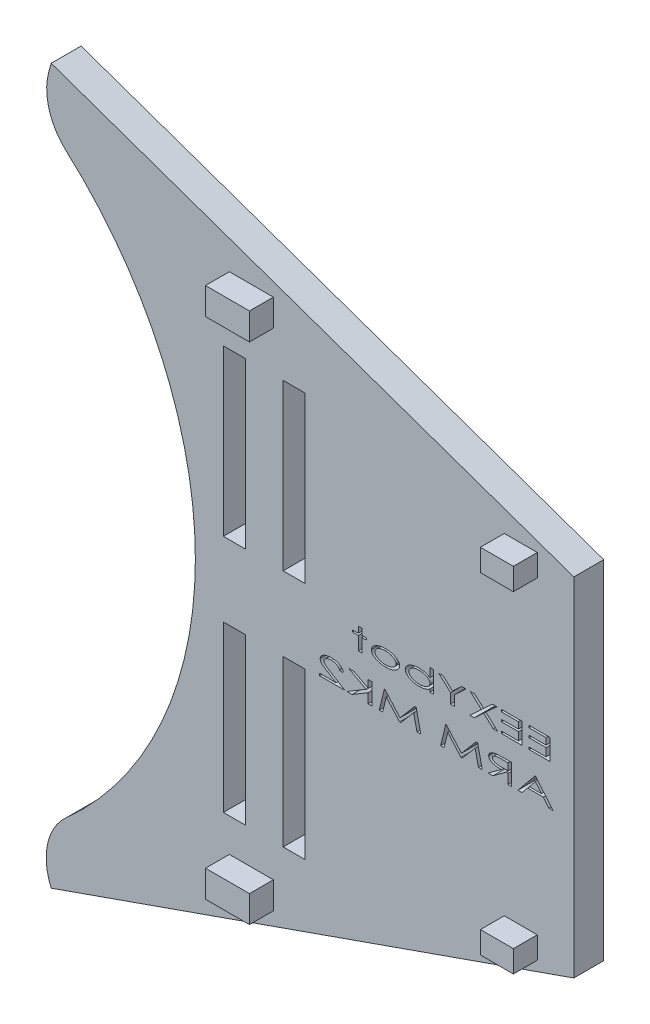
from build123d import *

# Parameters (mm, degrees)
EXTRUDE_1_DEPTH     = 5
FILLET_1_R          = 10
CUT_EXTRUDE_1_DEPTH = 107.69971335
SKETCH_3_W          = 3.678845839
SKETCH_3_H          = 27.591343796
CUT_EXTRUDE_2_DEPTH = 107.699713493
SKETCH_5_W          = 5.518268759
SKETCH_5_H          = 3.67884584
SKETCH_5_W_2        = 7.357691678
SKETCH_5_H_2        = 4.496367137
EXTRUDE_2_DEPTH     = 4


with BuildPart() as part:
    # 草图1 → 凸台-拉伸1 (new body)
    with BuildSketch(Plane.XY):
        with BuildLine():
            Line((0, 29.052064759), (0, -29.052064759))
            Line((0, -29.052064759), (-87.42568435, -59.751160027))
            Line((-87.42568435, -59.751160027), (-91.643949464, -53.551128693))
            ThreePointArc((-91.643949464, -53.551128693), (-63.451535914, -4.310229449), (-84.85515522, 48.23844723))
            ThreePointArc((-84.85515522, 48.23844723), (-87.784902179, 52.896492408), (-87.806774762, 58.399248419))
            Line((-87.806774762, 58.399248419), (-87.42568435, 59.751160027))
            Line((-87.42568435, 59.751160027), (0, 29.052064759))
        make_face()
    extrude(amount=EXTRUDE_1_DEPTH)

    # 圆角1
    # the kernel refuses this fillet: 10 mm, written as the material it takes off along each edge
    with BuildSketch(Plane(origin=(-91.643949464, -53.551128693, -21.327888809), x_dir=(0.5625146106856179, -0.8267873443426718, 0), z_dir=(0, 0, 1))) as fillet_1_piece_1:
        with BuildLine():
            CenterArc((9.351418919, 9.826918831), FILLET_1_R, 187.552141493, 71.772291788)
            Line((-0.561837747, 8.512634898), (-0.760102881, 8.48634922))
            ThreePointArc((-0.760102881, 8.48634922), (-0.340177879, 4.252406328), (-0.2, 0))
            Line((-0.2, 0), (0, -0.2))
            ThreePointArc((0, -0.2), (3.7494716, -0.2), (7.461893686, -0.196538377))
            Line((7.461893686, -0.196538377), (7.4989432, 0))
        make_face()
    extrude(amount=47.655777618, mode=Mode.SUBTRACT)

    # 草图2 → 切除-拉伸1 (cut, through all)
    # profile 1 of 13: a face of its own
    with BuildSketch(Plane(origin=(0, 0, 0), x_dir=(-1, 0, 0), z_dir=(0, 0, -1))):
        Polygon((4.016189414, 3.806570487), (7.516189414, 3.806570487), (7.516189414, 3.447596128), (4.644394543, 3.447596128), (4.644394543, 2.370673051), (7.471317619, 2.370673051), (7.471317619, 2.011698692), (4.644394543, 2.011698692), (4.644394543, 0.665544846), (7.471317619, 0.665544846), (7.471317619, 0.306570487), (4.016189414, 0.306570487), align=None)
    # profile 2 of 13: a face of its own
    with BuildSketch(Plane(origin=(0, 0, 0), x_dir=(-1, 0, 0), z_dir=(0, 0, -1))):
        Polygon((8.637984286, 3.806570487), (12.137984286, 3.806570487), (12.137984286, 3.447596128), (9.266189414, 3.447596128), (9.266189414, 2.370673051), (12.093112491, 2.370673051), (12.093112491, 2.011698692), (9.266189414, 2.011698692), (9.266189414, 0.665544846), (12.093112491, 0.665544846), (12.093112491, 0.306570487), (8.637984286, 0.306570487), align=None)
    # profile 3 of 13: a face of its own
    with BuildSketch(Plane(origin=(0, 0, 0), x_dir=(-1, 0, 0), z_dir=(0, 0, -1))):
        Polygon((12.878368902, 3.806570487), (13.618052395, 3.806570487), (15.090408164, 2.447796448), (16.578188613, 3.806570487), (17.320676594, 3.806570487), (15.459198228, 2.107752378), (17.410420184, 0.306570487), (16.670035568, 0.306570487), (15.086902555, 1.767708307), (13.486241498, 0.306570487), (12.743753517, 0.306570487), (14.718112491, 2.108453499), align=None)
    # profile 4 of 13: a face of its own
    with BuildSketch(Plane(origin=(0, 0, 0), x_dir=(-1, 0, 0), z_dir=(0, 0, -1))):
        Polygon((18.016189414, 3.806570487), (18.750965055, 3.806570487), (20.304650953, 2.361558467), (21.85833685, 3.806570487), (22.593112491, 3.806570487), (20.618753517, 1.970332506), (20.618753517, 0.306570487), (19.990548389, 0.306570487), (19.990548389, 1.970332506), align=None)
    # profile 5 of 13: a face of its own
    with BuildSketch(Plane(origin=(0, 0, 0), x_dir=(-1, 0, 0), z_dir=(0, 0, -1))):
        with BuildLine():
            Line((23.490548389, 0.306570487), (23.490548389, 3.896314076))
            Line((23.490548389, 3.896314076), (24.073881722, 3.896314076))
            Line((24.073881722, 3.896314076), (24.073881722, 2.400120166))
            add(Edge.make_bspline(
                [(24.073881722, 2.400120166), (24.1357726, 2.441324692), (24.259920703, 2.523977645), (24.460874302, 2.626147078), (24.671439312, 2.714228745), (24.893329907, 2.7858362), (25.125995921, 2.840860915), (25.369368956, 2.880754998), (25.623565134, 2.90504227), (25.796717467, 2.907753928), (25.884879318, 2.909134589)],
                knots=[0, 0, 0, 0, 0.933129887, 1.871783208, 2.825732017, 3.797593647, 4.796442418, 5.825719888, 6.892948443, 8, 8, 8, 8], degree=3))
            add(Edge.make_bspline(
                [(25.884879318, 2.909134589), (25.963441562, 2.907919638), (26.117743552, 2.905533384), (26.344802786, 2.886841313), (26.563024309, 2.85701893), (26.772740115, 2.815138593), (26.973470808, 2.760448225), (27.165550516, 2.693651452), (27.349111503, 2.61537119), (27.494168395, 2.539139537), (27.604069385, 2.4734381), (27.681285006, 2.423266439), (27.752682634, 2.371002255), (27.819890792, 2.318815816), (27.880545728, 2.263984531), (27.936400428, 2.208427512), (27.986953047, 2.151518282), (28.032774841, 2.093478068), (28.072613451, 2.033808957), (28.107627061, 1.97315522), (28.135978091, 1.910687002), (28.160098038, 1.847287347), (28.17922186, 1.782667223), (28.192526759, 1.716508611), (28.200316879, 1.648938543), (28.201493931, 1.603431937), (28.20208685, 1.580508788)],
                knots=[0, 0, 0, 0, 1.935959526, 3.802366051, 5.610679168, 7.361519894, 9.068963146, 10.733850587, 12.369701887, 13.982464193, 14.767752749, 15.524975027, 16.25079097, 16.947931074, 17.620931439, 18.264423722, 18.888629472, 19.495836026, 20.085300369, 20.655396126, 21.219789758, 21.773921371, 22.326163945, 22.87852665, 23.435077607, 24, 24, 24, 24], degree=3))
            add(Edge.make_bspline(
                [(28.20208685, 1.580508788), (28.201486048, 1.558053294), (28.200287247, 1.513247142), (28.192529993, 1.446607078), (28.179209297, 1.381149478), (28.160048322, 1.316930998), (28.135631654, 1.254099405), (28.105690321, 1.192674666), (28.071497456, 1.132177888), (28.031310032, 1.073163621), (27.985331096, 1.015551847), (27.934474822, 0.958930629), (27.877702973, 0.904040496), (27.816159614, 0.849915612), (27.748462547, 0.797743419), (27.676573074, 0.745370183), (27.598216567, 0.696128877), (27.48782027, 0.630140549), (27.34113522, 0.554975826), (27.156262209, 0.476308764), (26.962742023, 0.409707334), (26.760400836, 0.35599613), (26.549797884, 0.312888286), (26.330094594, 0.283136321), (26.101815675, 0.265545411), (25.946842916, 0.262995238), (25.868052395, 0.261698692)],
                knots=[0, 0, 0, 0, 0.552128719, 1.101679763, 1.647129623, 2.192579484, 2.747482211, 3.302622916, 3.871395944, 4.454728798, 5.056012825, 5.682602691, 6.324653384, 6.996583871, 7.69662575, 8.425416702, 9.182584813, 9.970988046, 11.587553174, 13.230176618, 14.907492215, 16.615020367, 18.374202868, 20.189705451, 22.062787961, 24, 24, 24, 24], degree=3))
            add(Edge.make_bspline(
                [(25.868052395, 0.261698692), (25.778027992, 0.263131696), (25.602109834, 0.265931953), (25.344598105, 0.289181748), (25.100406297, 0.328641403), (24.905427136, 0.372983653), (24.756948381, 0.418554318), (24.649599127, 0.456476298), (24.545169547, 0.498092206), (24.444448896, 0.545478653), (24.347025704, 0.597460132), (24.252447425, 0.653490328), (24.160775638, 0.713555172), (24.102841987, 0.757740192), (24.073881722, 0.779827698)],
                knots=[0, 0, 0, 0, 1.702951235, 3.327764837, 4.886222515, 6.380187064, 7.106072106, 7.823450813, 8.533653908, 9.231878437, 9.92812628, 10.621955221, 11.311133658, 12, 12, 12, 12], degree=3))
            Line((24.073881722, 0.779827698), (24.073881722, 0.306570487))
            Line((24.073881722, 0.306570487), (23.490548389, 0.306570487))
        make_face()
        with BuildLine():
            add(Edge.make_bspline(
                [(25.844214254, 0.575801256), (25.922800738, 0.577442902), (26.07755935, 0.580675758), (26.304804027, 0.605401193), (26.522768915, 0.646958297), (26.696972909, 0.694759594), (26.82993925, 0.740775573), (26.92401672, 0.778656119), (27.013103934, 0.819786407), (27.096525391, 0.86477881), (27.17485763, 0.912538204), (27.247963404, 0.963783146), (27.315834352, 1.018399884), (27.378534784, 1.075662929), (27.433876284, 1.135781685), (27.483741247, 1.196005942), (27.525447566, 1.25794662), (27.558855315, 1.321182174), (27.586143742, 1.384527029), (27.605190825, 1.448974783), (27.616870288, 1.514407177), (27.618126292, 1.558493115), (27.618753517, 1.580508788)],
                knots=[0, 0, 0, 0, 2.118672663, 4.172254865, 6.154612558, 8.096197483, 9.036840582, 9.947235493, 10.829678337, 11.681134898, 12.501427085, 13.302121526, 14.086481727, 14.849074134, 15.589232038, 16.287994741, 16.955632612, 17.598391307, 18.214011709, 18.812161815, 19.406816371, 20, 20, 20, 20], degree=3))
            add(Edge.make_bspline(
                [(27.618753517, 1.580508788), (27.61820117, 1.602536765), (27.617094082, 1.646688222), (27.604224103, 1.712195117), (27.585290523, 1.776996426), (27.559283393, 1.84141101), (27.52468847, 1.90451533), (27.481836528, 1.966304388), (27.433035848, 2.028245262), (27.376110758, 2.088111392), (27.313129336, 2.145931018), (27.245112166, 2.201675428), (27.171304149, 2.253297629), (27.092543061, 2.302015246), (27.008137981, 2.346489805), (26.919003657, 2.388911416), (26.824325222, 2.427233376), (26.691073371, 2.473885087), (26.51763659, 2.523602613), (26.301881238, 2.564002212), (26.079512393, 2.590439185), (25.928893142, 2.59348818), (25.852627716, 2.595032025)],
                knots=[0, 0, 0, 0, 0.594415692, 1.191408463, 1.796857409, 2.417172796, 3.064262108, 3.736823613, 4.446877225, 5.192887719, 5.965986925, 6.755948685, 7.567104021, 8.397785828, 9.256577464, 10.143532152, 11.064041842, 12.014684237, 13.957625508, 15.931696863, 17.940031759, 20, 20, 20, 20], degree=3))
            add(Edge.make_bspline(
                [(25.852627716, 2.595032025), (25.774729401, 2.593477743), (25.620621175, 2.590402867), (25.392651765, 2.563991317), (25.170242101, 2.523284701), (24.990579878, 2.47407503), (24.852702158, 2.427402629), (24.755628814, 2.389442522), (24.664527911, 2.348926334), (24.57923914, 2.305692712), (24.500976214, 2.258424933), (24.428012497, 2.209620746), (24.362101911, 2.156603265), (24.30179751, 2.101651141), (24.24823526, 2.044026731), (24.20185563, 1.984372149), (24.162406885, 1.923161249), (24.129483719, 1.860531567), (24.105214909, 1.795328229), (24.086590331, 1.728834286), (24.075892012, 1.660081959), (24.074556247, 1.613730645), (24.073881722, 1.590324493)],
                knots=[0, 0, 0, 0, 2.087793965, 4.130336117, 6.144475519, 8.144757894, 9.117619803, 10.046110953, 10.938027435, 11.78989352, 12.607618329, 13.387903761, 14.141364737, 14.873044463, 15.573558121, 16.247829355, 16.89609788, 17.523814407, 18.140552933, 18.757673263, 19.372658827, 20, 20, 20, 20], degree=3))
            add(Edge.make_bspline(
                [(24.073881722, 1.590324493), (24.075202536, 1.554879365), (24.077824658, 1.484512541), (24.103923359, 1.381728329), (24.144018323, 1.283392605), (24.200392328, 1.189422351), (24.273764648, 1.101120526), (24.362022121, 1.016441085), (24.466976725, 0.93736716), (24.586008685, 0.863182933), (24.716791776, 0.796058339), (24.856184385, 0.736907403), (25.002953971, 0.687237545), (25.157184252, 0.646804978), (25.318395716, 0.614190539), (25.487351876, 0.592553803), (25.663291856, 0.577694996), (25.783184174, 0.576440066), (25.844214254, 0.575801256)],
                knots=[0, 0, 0, 0, 0.758890678, 1.506574479, 2.259615688, 3.030707725, 3.846449968, 4.714999263, 5.648358164, 6.659464446, 7.719850581, 8.797942469, 9.904351004, 11.03993024, 12.215632816, 13.429275068, 14.69139614, 16, 16, 16, 16], degree=3))
        make_face(mode=Mode.SUBTRACT)
    # profile 6 of 13: a face of its own
    with BuildSketch(Plane(origin=(0, 0, 0), x_dir=(-1, 0, 0), z_dir=(0, 0, -1))):
        with BuildLine():
            add(Edge.make_bspline(
                [(31.502267139, 2.909134589), (31.587380924, 2.908097096), (31.754357288, 2.90606174), (31.998962718, 2.884987508), (32.23239743, 2.852368963), (32.454907257, 2.807221056), (32.665970401, 2.747610938), (32.86608761, 2.675078231), (33.055608489, 2.590611498), (33.173604175, 2.521784559), (33.231934607, 2.48776039)],
                knots=[0, 0, 0, 0, 1.132869246, 2.222464757, 3.265724845, 4.269488396, 5.242622833, 6.182557835, 7.101558799, 8, 8, 8, 8], degree=3))
            add(Edge.make_bspline(
                [(33.231934607, 2.48776039), (33.28148518, 2.456033691), (33.376812516, 2.394996622), (33.503292802, 2.290830863), (33.61208136, 2.184184691), (33.701645019, 2.072460966), (33.770395029, 1.955157777), (33.819467454, 1.833562885), (33.850399873, 1.707546771), (33.854083134, 1.621580747), (33.855933004, 1.578405423)],
                knots=[0, 0, 0, 0, 1.222207996, 2.351331692, 3.399173276, 4.384840486, 5.318962934, 6.214865304, 7.103439159, 8, 8, 8, 8], degree=3))
            add(Edge.make_bspline(
                [(33.855933004, 1.578405423), (33.855348386, 1.556647347), (33.854181856, 1.513231871), (33.846188735, 1.448778857), (33.83375576, 1.385135868), (33.815152566, 1.322686682), (33.792320435, 1.261136581), (33.763700346, 1.200767178), (33.730199463, 1.141484628), (33.691479816, 1.083194187), (33.647719674, 1.026002346), (33.598409687, 0.970151225), (33.544532863, 0.9144817), (33.48476971, 0.860725258), (33.41999414, 0.808103416), (33.350458941, 0.756278425), (33.276144677, 0.70482934), (33.168885128, 0.638473778), (33.026115285, 0.560267447), (32.84247149, 0.481010746), (32.64786611, 0.412701402), (32.44128894, 0.357546555), (32.22326065, 0.314196332), (31.993296081, 0.283672069), (31.751700605, 0.26530395), (31.586668372, 0.262918609), (31.502267139, 0.261698692)],
                knots=[0, 0, 0, 0, 0.531232046, 1.060006093, 1.583798455, 2.11294193, 2.649299108, 3.185413343, 3.74250114, 4.310731507, 4.892862905, 5.499514304, 6.12908611, 6.783615121, 7.461007126, 8.166380433, 8.900887032, 9.667334043, 11.245504996, 12.870888778, 14.545821525, 16.277655353, 18.087425461, 19.970398581, 21.939170284, 24, 24, 24, 24], degree=3))
            add(Edge.make_bspline(
                [(31.502267139, 0.261698692), (31.417632371, 0.262924442), (31.251900587, 0.265324706), (31.009372522, 0.283652757), (30.778682314, 0.314089068), (30.560037247, 0.357784418), (30.352857368, 0.4124373), (30.157863809, 0.481039987), (29.974210231, 0.560259785), (29.83144266, 0.638474689), (29.724182827, 0.704829179), (29.649868616, 0.756278465), (29.580333404, 0.808103406), (29.515557838, 0.86072526), (29.455794683, 0.914481699), (29.40191786, 0.970151225), (29.352607872, 1.026002346), (29.30884773, 1.083194187), (29.270128083, 1.141484628), (29.2366272, 1.200767178), (29.208007112, 1.261136581), (29.18517498, 1.322686682), (29.166571787, 1.385135868), (29.154138812, 1.448778857), (29.146145691, 1.513231871), (29.14497916, 1.556647347), (29.144394543, 1.578405423)],
                knots=[0, 0, 0, 0, 2.06363153, 4.041002794, 5.92697862, 7.734206147, 9.474614182, 11.147193784, 12.770294033, 14.346247783, 15.111617997, 15.845092673, 16.549474988, 17.225915312, 17.879524762, 18.50821207, 19.114011173, 19.695324724, 20.262756772, 20.819061906, 21.354422944, 21.890026583, 22.418426654, 22.94148313, 23.469514292, 24, 24, 24, 24], degree=3))
            add(Edge.make_bspline(
                [(29.144394543, 1.578405423), (29.146254169, 1.6213489), (29.149966868, 1.707084518), (29.180933987, 1.832818667), (29.229615121, 1.954545257), (29.299567536, 2.07067557), (29.388595311, 2.182376058), (29.496591526, 2.289470809), (29.623791883, 2.392787898), (29.718894574, 2.453867008), (29.76839294, 2.485657025)],
                knots=[0, 0, 0, 0, 0.893170725, 1.783193831, 2.680557403, 3.614480611, 4.594919164, 5.64790525, 6.775798602, 8, 8, 8, 8], degree=3))
            add(Edge.make_bspline(
                [(29.76839294, 2.485657025), (29.826949313, 2.519928675), (29.944937276, 2.588984219), (30.134731807, 2.673799683), (30.334717419, 2.746999943), (30.546441444, 2.806353208), (30.769459706, 2.852690907), (31.003731922, 2.884806596), (31.249234385, 2.906139467), (31.416683322, 2.908121542), (31.502267139, 2.909134589)],
                knots=[0, 0, 0, 0, 0.900262614, 1.813981068, 2.755379512, 3.725911737, 4.730658635, 5.7772741, 6.863955976, 8, 8, 8, 8], degree=3))
        make_face()
        with BuildLine():
            add(Edge.make_bspline(
                [(31.500163773, 2.595032025), (31.440539448, 2.59407949), (31.323460092, 2.592209074), (31.150946876, 2.577763441), (30.984928187, 2.554947904), (30.824893591, 2.522747117), (30.671467584, 2.480763846), (30.524380042, 2.429402056), (30.383543922, 2.369219413), (30.251172941, 2.299573941), (30.129247773, 2.224686366), (30.02268234, 2.143804016), (29.932115877, 2.059519702), (29.856930677, 1.971553653), (29.799642499, 1.878135713), (29.758402882, 1.781089113), (29.732580395, 1.67999442), (29.729353542, 1.611040543), (29.727727876, 1.576302057)],
                knots=[0, 0, 0, 0, 1.28083595, 2.5150716, 3.716527527, 4.87945969, 6.019579319, 7.131137267, 8.224239049, 9.306738011, 10.341915636, 11.294926342, 12.175878415, 12.995547139, 13.773153167, 14.520134758, 15.25445415, 16, 16, 16, 16], degree=3))
            add(Edge.make_bspline(
                [(29.727727876, 1.576302057), (29.728360573, 1.553822367), (29.729627334, 1.508814387), (29.741217732, 1.441952331), (29.760558879, 1.376333302), (29.786356086, 1.31149307), (29.820500263, 1.248363623), (29.861293738, 1.18622036), (29.910257544, 1.125768766), (29.966166685, 1.066628416), (30.0280044, 1.00938481), (30.095976421, 0.95615314), (30.168520417, 0.905197563), (30.246544433, 0.857938375), (30.330079135, 0.814317893), (30.418246792, 0.773713258), (30.511837682, 0.736438943), (30.644446048, 0.691649268), (30.818774291, 0.644411478), (31.037195653, 0.605323629), (31.265373767, 0.579574328), (31.420864441, 0.577075595), (31.500163773, 0.575801256)],
                knots=[0, 0, 0, 0, 0.605545809, 1.212400766, 1.822418741, 2.447059813, 3.08958135, 3.753485606, 4.448031145, 5.183316258, 5.945627291, 6.716916587, 7.508542197, 8.333909708, 9.173576138, 10.047331898, 10.949200488, 11.887447595, 13.818919532, 15.810612379, 17.863436872, 20, 20, 20, 20], degree=3))
            add(Edge.make_bspline(
                [(31.500163773, 0.575801256), (31.579461095, 0.577091467), (31.735180272, 0.579625103), (31.963387469, 0.605183075), (32.181766521, 0.644518543), (32.355886163, 0.691637052), (32.488483485, 0.73645134), (32.582103223, 0.773671696), (32.67035664, 0.814551875), (32.754255489, 0.857518547), (32.831893058, 0.905443026), (32.904370988, 0.956119606), (32.972317944, 1.009393593), (33.034162197, 1.066626162), (33.090069671, 1.125769325), (33.139033891, 1.186220221), (33.179827263, 1.248363658), (33.213971466, 1.311493061), (33.239768666, 1.376333305), (33.259109815, 1.44195233), (33.270700213, 1.508814387), (33.271966974, 1.553822367), (33.272599671, 1.576302057)],
                knots=[0, 0, 0, 0, 2.136534215, 4.19559375, 6.18106403, 8.112509829, 9.05074424, 9.952600626, 10.826344561, 11.671580984, 12.491559412, 13.283174309, 14.054453167, 14.816753885, 15.552029048, 16.246565187, 16.91046046, 17.552973302, 18.177605921, 18.78761564, 19.394462385, 20, 20, 20, 20], degree=3))
            add(Edge.make_bspline(
                [(33.272599671, 1.576302057), (33.27097697, 1.6110422), (33.267756005, 1.679999366), (33.241889624, 1.781069537), (33.200773416, 1.878325312), (33.142632829, 1.971582809), (33.066796915, 2.059292811), (32.97620519, 2.144045352), (32.868924159, 2.224663469), (32.746472683, 2.299378341), (32.6138371, 2.369424809), (32.472603466, 2.429242462), (32.325563198, 2.480655432), (32.172426659, 2.522870974), (32.013036372, 2.554779291), (31.847529217, 2.577888234), (31.675927971, 2.592145858), (31.559319159, 2.594060653), (31.500163773, 2.595032025)],
                knots=[0, 0, 0, 0, 0.745828795, 1.480426872, 2.227691953, 3.008231892, 3.831451365, 4.712737773, 5.670110978, 6.70994837, 7.792858155, 8.890990961, 10.002970761, 11.13867948, 12.302052992, 13.494015883, 14.728719943, 16, 16, 16, 16], degree=3))
        make_face(mode=Mode.SUBTRACT)
    # profile 7 of 13: a face of its own
    with BuildSketch(Plane(origin=(0, 0, 0), x_dir=(-1, 0, 0), z_dir=(0, 0, -1))):
        Polygon((35.471317619, 3.896314076), (36.054650953, 3.896314076), (36.054650953, 2.864262794), (36.996958645, 2.864262794), (36.996958645, 2.55016023), (36.054650953, 2.55016023), (36.054650953, 0.306570487), (35.471317619, 0.306570487), (35.471317619, 2.55016023), (34.663625312, 2.55016023), (34.663625312, 2.864262794), (35.471317619, 2.864262794), align=None)
    # profile 8 of 13: a face of its own
    with BuildSketch(Plane(origin=(0, 0, 0), x_dir=(-1, 0, 0), z_dir=(0, 0, -1))):
        Polygon((6.484138132, -3.026762847), (9.355933004, -6.526762847), (8.663224671, -6.526762847), (7.742651754, -5.404967975), (5.106433805, -5.404967975), (4.171838453, -6.526762847), (3.477727876, -6.526762847), (6.394394543, -3.026762847), align=None)
        Polygon((6.434358485, -3.810617013), (5.40511169, -5.045993616), (7.4481806, -5.045993616), align=None, mode=Mode.SUBTRACT)
    # profile 9 of 13: a face of its own
    with BuildSketch(Plane(origin=(0, 0, 0), x_dir=(-1, 0, 0), z_dir=(0, 0, -1))):
        with BuildLine():
            Line((10.387984286, -3.026762847), (11.617050793, -3.026762847))
            add(Edge.make_bspline(
                [(11.617050793, -3.026762847), (11.699315568, -3.026916876), (11.856836879, -3.027211813), (12.082617555, -3.02889073), (12.287797065, -3.033664888), (12.472242438, -3.03773562), (12.636045764, -3.045291166), (12.778920322, -3.052328394), (12.90121701, -3.061863499), (12.975611081, -3.070505083), (13.009478677, -3.074439129)],
                knots=[0, 0, 0, 0, 1.416417029, 2.712167703, 3.887393292, 4.950075141, 5.888505956, 6.71057319, 7.412993731, 8, 8, 8, 8], degree=3))
            add(Edge.make_bspline(
                [(13.009478677, -3.074439129), (13.05419322, -3.080753922), (13.142121076, -3.093171497), (13.27006174, -3.119313991), (13.39173257, -3.150165589), (13.506924938, -3.185476053), (13.615328311, -3.227333672), (13.717629562, -3.273212744), (13.813637453, -3.324482821), (13.901964484, -3.381092328), (13.983078101, -3.440686217), (14.053238895, -3.505213414), (14.112994327, -3.572971677), (14.161841379, -3.64425804), (14.200179185, -3.718842376), (14.227057114, -3.797232128), (14.243641117, -3.878863695), (14.245846613, -3.934638335), (14.246958645, -3.962760443)],
                knots=[0, 0, 0, 0, 1.307816027, 2.571723943, 3.780153008, 4.942814062, 6.05922659, 7.14388766, 8.188801919, 9.208523121, 10.180641294, 11.100512652, 11.964057046, 12.792111745, 13.597440323, 14.385279682, 15.185842538, 16, 16, 16, 16], degree=3))
            add(Edge.make_bspline(
                [(14.246958645, -3.962760443), (14.246369216, -3.986415419), (14.245201003, -4.033298196), (14.233280608, -4.102332417), (14.215457226, -4.169307482), (14.188852465, -4.233820214), (14.155324453, -4.296146284), (14.113884721, -4.356078745), (14.066404597, -4.414569893), (14.010632141, -4.469861452), (13.948084357, -4.522040513), (13.879924471, -4.572425853), (13.804759893, -4.61815769), (13.723706771, -4.661421518), (13.635791203, -4.70020617), (13.541869721, -4.73685148), (13.441399032, -4.769607165), (13.334075105, -4.799347357), (13.21817401, -4.825066005), (13.092924894, -4.848452603), (12.956894683, -4.866796543), (12.810810875, -4.883017753), (12.653915273, -4.895499127), (12.486758503, -4.904414188), (12.309096913, -4.910109439), (12.187300955, -4.910947321), (12.124662972, -4.911378231)],
                knots=[0, 0, 0, 0, 0.666545885, 1.321054874, 1.970265186, 2.617766739, 3.284280033, 3.962553192, 4.669800674, 5.406209944, 6.17336419, 6.965703278, 7.794359523, 8.652405894, 9.555234163, 10.502653656, 11.494827889, 12.534263488, 13.642421403, 14.842163438, 16.126690336, 17.512607952, 18.987269017, 20.564940475, 22.233396202, 24, 24, 24, 24], degree=3))
            Line((12.124662972, -4.911378231), (14.336702235, -6.526762847))
            Line((14.336702235, -6.526762847), (13.542331241, -6.526762847))
            Line((13.542331241, -6.526762847), (11.330291978, -4.911378231))
            Line((11.330291978, -4.911378231), (11.016189414, -4.911378231))
            Line((11.016189414, -4.911378231), (11.016189414, -6.526762847))
            Line((11.016189414, -6.526762847), (10.387984286, -6.526762847))
            Line((10.387984286, -6.526762847), (10.387984286, -3.026762847))
        make_face()
        with BuildLine():
            Line((11.016189414, -3.385737206), (11.016189414, -4.552403872))
            Line((11.016189414, -4.552403872), (12.078388934, -4.557311725))
            add(Edge.make_bspline(
                [(12.078388934, -4.557311725), (12.128172031, -4.557330635), (12.224246616, -4.557367128), (12.363534603, -4.553326353), (12.492814549, -4.54885207), (12.612041912, -4.541886742), (12.720997281, -4.532884215), (12.819923272, -4.521806221), (12.909060829, -4.508665566), (13.012323024, -4.488814277), (13.127550457, -4.457278549), (13.252599248, -4.41169405), (13.360461813, -4.353379364), (13.438480438, -4.297112761), (13.491761468, -4.248006743), (13.525574091, -4.210169617), (13.553638852, -4.171059994), (13.578073106, -4.131931971), (13.596492715, -4.090901793), (13.608903113, -4.048625478), (13.617008946, -4.005601101), (13.618171541, -3.97658455), (13.618753517, -3.962059321)],
                knots=[0, 0, 0, 0, 1.658151085, 3.200005358, 4.641198232, 5.966878246, 7.177737174, 8.282418709, 9.282073468, 10.17825669, 11.783426624, 13.256723866, 14.601195913, 15.854623048, 16.449526013, 17.01196441, 17.541378601, 18.051377885, 18.546178684, 19.033824171, 19.516347583, 20, 20, 20, 20], degree=3))
            add(Edge.make_bspline(
                [(13.618753517, -3.962059321), (13.61816351, -3.947772178), (13.616994252, -3.919458328), (13.609126368, -3.877429554), (13.595429616, -3.836660024), (13.577416748, -3.796365307), (13.552916201, -3.757788033), (13.52432284, -3.719570698), (13.489406238, -3.683307481), (13.436425011, -3.634949371), (13.359962967, -3.579615574), (13.255376821, -3.523899017), (13.137818414, -3.478736072), (13.029793788, -3.449703369), (12.93286154, -3.431548575), (12.847735956, -3.419095731), (12.751146873, -3.408643139), (12.643556804, -3.400681662), (12.524604873, -3.393439829), (12.394393085, -3.388783442), (12.252747802, -3.385937703), (12.154579036, -3.38580571), (12.103629318, -3.385737206)],
                knots=[0, 0, 0, 0, 0.485207651, 0.961570568, 1.445998559, 1.943261303, 2.456484379, 2.994634377, 3.561740015, 4.162925541, 5.429819412, 6.75440093, 8.176773253, 9.697835522, 10.546222895, 11.525041337, 12.618932989, 13.844963593, 15.188692812, 16.666052942, 18.269677105, 20, 20, 20, 20], degree=3))
            Line((12.103629318, -3.385737206), (11.016189414, -3.385737206))
        make_face(mode=Mode.SUBTRACT)
    # profile 10 of 13: a face of its own
    with BuildSketch(Plane(origin=(0, 0, 0), x_dir=(-1, 0, 0), z_dir=(0, 0, -1))):
        Polygon((15.323881722, -6.526762847), (16.09651794, -3.026762847), (16.348220664, -3.026762847), (18.801445825, -5.898557719), (21.335299991, -3.026762847), (21.417331241, -3.026762847), (22.279009927, -6.526762847), (21.708997908, -6.526762847), (21.089907363, -4.013942334), (18.872960248, -6.526762847), (18.659819222, -6.526762847), (16.512984286, -4.013942334), (15.958396946, -6.526762847), align=None)
    # profile 11 of 13: a face of its own
    with BuildSketch(Plane(origin=(0, 0, 0), x_dir=(-1, 0, 0), z_dir=(0, 0, -1))):
        Polygon((25.599522748, -6.526762847), (26.372158966, -3.026762847), (26.62386169, -3.026762847), (29.07708685, -5.898557719), (31.610941017, -3.026762847), (31.692972267, -3.026762847), (32.554650953, -6.526762847), (31.984638934, -6.526762847), (31.365548389, -4.013942334), (29.148601273, -6.526762847), (28.935460248, -6.526762847), (26.788625312, -4.013942334), (26.234037972, -6.526762847), align=None)
    # profile 12 of 13: a face of its own
    with BuildSketch(Plane(origin=(0, 0, 0), x_dir=(-1, 0, 0), z_dir=(0, 0, -1))):
        Polygon((33.766189414, -3.026762847), (34.394394543, -3.026762847), (34.394394543, -4.28597759), (36.774001914, -3.026762847), (37.692471466, -3.026762847), (34.724622908, -4.597275667), (37.961702235, -6.526762847), (37.09651794, -6.526762847), (34.394394543, -4.916286084), (34.394394543, -6.526762847), (33.766189414, -6.526762847), align=None)
    # profile 13 of 13: a face of its own
    with BuildSketch(Plane(origin=(0, 0, 0), x_dir=(-1, 0, 0), z_dir=(0, 0, -1))):
        with BuildLine():
            Line((39.195676594, -4.103685924), (38.567471466, -4.103685924))
            add(Edge.make_bspline(
                [(38.567471466, -4.103685924), (38.571163191, -4.061899782), (38.578477035, -3.979115368), (38.610806323, -3.858678974), (38.660861864, -3.744522646), (38.727135526, -3.635814921), (38.81140206, -3.533591881), (38.911446575, -3.436256154), (39.029717046, -3.34606594), (39.163024034, -3.262171355), (39.308686391, -3.185410086), (39.464530453, -3.119047051), (39.628656995, -3.062986946), (39.800749439, -3.016548899), (39.981442928, -2.981172495), (40.170322561, -2.955261034), (40.36768406, -2.939560513), (40.502071167, -2.937877295), (40.570576434, -2.937019257)],
                knots=[0, 0, 0, 0, 0.792333241, 1.569727201, 2.345812882, 3.143394519, 3.969819973, 4.845153681, 5.778005485, 6.777522579, 7.821592192, 8.889058324, 9.978091973, 11.099762135, 12.258023523, 13.458374983, 14.704379431, 16, 16, 16, 16], degree=3))
            add(Edge.make_bspline(
                [(40.570576434, -2.937019257), (40.638145119, -2.93791973), (40.770177554, -2.939679297), (40.963071032, -2.954593554), (41.146158924, -2.978976743), (41.31935663, -3.012910491), (41.482533283, -3.057334725), (41.636196258, -3.110180201), (41.779718815, -3.174128687), (41.911988715, -3.247587525), (42.032252131, -3.326221319), (42.136429889, -3.410933284), (42.225873158, -3.497732548), (42.299221659, -3.588769859), (42.355943566, -3.683941088), (42.396428446, -3.78290103), (42.422380329, -3.88524084), (42.42508993, -3.955130926), (42.426445825, -3.990104193)],
                knots=[0, 0, 0, 0, 1.386812386, 2.709897552, 3.968433488, 5.176445875, 6.329713579, 7.43724515, 8.508837806, 9.55023929, 10.540148442, 11.454198015, 12.302267464, 13.094177349, 13.846979117, 14.56768537, 15.283264257, 16, 16, 16, 16], degree=3))
            add(Edge.make_bspline(
                [(42.426445825, -3.990104193), (42.425911041, -4.014933698), (42.424845191, -4.064420124), (42.411927637, -4.137584727), (42.39339529, -4.209946622), (42.36544997, -4.280548374), (42.331087584, -4.350797142), (42.287866673, -4.419081152), (42.238079837, -4.48709482), (42.17808418, -4.553777021), (42.108406247, -4.623883106), (42.023758236, -4.69704536), (41.926232427, -4.777861274), (41.812594555, -4.86268774), (41.686095824, -4.955020264), (41.543532742, -5.051182871), (41.38790581, -5.155382758), (41.277726294, -5.22459757), (41.220516337, -5.260536885)],
                knots=[0, 0, 0, 0, 0.65272305, 1.300909207, 1.949912014, 2.615861563, 3.295309181, 4.005334899, 4.739771894, 5.511094034, 6.363568823, 7.339726715, 8.454131166, 9.696633352, 11.070948895, 12.57570215, 14.221956897, 16, 16, 16, 16], degree=3))
            Line((41.220516337, -5.260536885), (39.766389735, -6.167788488))
            Line((39.766389735, -6.167788488), (42.516189414, -6.167788488))
            Line((42.516189414, -6.167788488), (42.516189414, -6.526762847))
            Line((42.516189414, -6.526762847), (38.343112491, -6.526762847))
            Line((38.343112491, -6.526762847), (40.665928998, -5.078245219))
            add(Edge.make_bspline(
                [(40.665928998, -5.078245219), (40.722335422, -5.043791047), (40.830368968, -4.977801998), (40.983949489, -4.881070132), (41.122119361, -4.791373359), (41.24518548, -4.708890414), (41.352086545, -4.63266672), (41.444033005, -4.563837617), (41.520478904, -4.501831258), (41.583210682, -4.445415168), (41.634915087, -4.391876197), (41.678229709, -4.338824208), (41.715310224, -4.285024217), (41.745478967, -4.230576629), (41.768841131, -4.175304998), (41.786094142, -4.119496586), (41.795970054, -4.062669995), (41.797487056, -4.024494369), (41.798240696, -4.005528872)],
                knots=[0, 0, 0, 0, 1.959780506, 3.753509237, 5.381474594, 6.844063042, 8.145817243, 9.27394652, 10.249065673, 11.063394855, 11.774033949, 12.453692358, 13.09181049, 13.709004761, 14.295890523, 14.868027222, 15.437640518, 16, 16, 16, 16], degree=3))
            add(Edge.make_bspline(
                [(41.798240696, -4.005528872), (41.797171528, -3.981595027), (41.795048001, -3.934058873), (41.777598713, -3.864237095), (41.74812958, -3.797539819), (41.707494059, -3.733290578), (41.656064305, -3.671373033), (41.592480116, -3.612852059), (41.517697398, -3.557059903), (41.432987912, -3.503541937), (41.339706569, -3.455217127), (41.240750865, -3.412155028), (41.136520451, -3.376599581), (41.027393176, -3.347090565), (40.912914617, -3.323810601), (40.79317379, -3.30821501), (40.668441581, -3.298022324), (40.583684809, -3.296679131), (40.540428196, -3.295993616)],
                knots=[0, 0, 0, 0, 0.727674161, 1.445268471, 2.174643741, 2.938338395, 3.751529703, 4.617060701, 5.561567616, 6.587626865, 7.662866366, 8.755512416, 9.868864306, 11.011012212, 12.193823562, 13.420964697, 14.68375909, 16, 16, 16, 16], degree=3))
            add(Edge.make_bspline(
                [(40.540428196, -3.295993616), (40.495072985, -3.296710878), (40.406124352, -3.298117542), (40.275701412, -3.307835111), (40.15119464, -3.324743093), (40.032480868, -3.347821725), (39.919402895, -3.376929007), (39.812274882, -3.413495359), (39.711171331, -3.457169343), (39.616176502, -3.506346203), (39.52896055, -3.561718681), (39.450633615, -3.622408681), (39.38296247, -3.689562431), (39.324791325, -3.761544573), (39.276468953, -3.839076862), (39.239775028, -3.922678857), (39.21051216, -4.010790433), (39.200672049, -4.072406012), (39.195676594, -4.103685924)],
                knots=[0, 0, 0, 0, 1.268457268, 2.48764228, 3.65514874, 4.780640362, 5.868197746, 6.918240767, 7.94299768, 8.945777236, 9.906786621, 10.828609131, 11.711392697, 12.56682027, 13.412099109, 14.257605361, 15.11545176, 16, 16, 16, 16], degree=3))
        make_face()
    extrude(amount=-CUT_EXTRUDE_1_DEPTH, mode=Mode.SUBTRACT)


with BuildPart() as cut_extrude_1_piece_1:
    # of the separate pieces the step leaves, piece 1, a body of its own (cut_extrude_1_pieces)
    add(part.part.solids().sort_by_distance((-84.85515522, 48.23844723, 0))[0])

    # 草图3 → 切除-拉伸2 (cut, through all)
    with BuildSketch(Plane(origin=(0, 0, 0), x_dir=(-1, 0, 0), z_dir=(0, 0, -1))):
        with Locations((56.786378002, 19.416130819)):
            Rectangle(SKETCH_3_W, SKETCH_3_H)
        with Locations((46.786378001, 19.416130819)):
            Rectangle(SKETCH_3_W, SKETCH_3_H)
        with Locations((56.786378002, -20.583869181)):
            Rectangle(SKETCH_3_W, SKETCH_3_H)
        with Locations((46.786378001, -20.583869181)):
            Rectangle(SKETCH_3_W, SKETCH_3_H)
    extrude(amount=-CUT_EXTRUDE_2_DEPTH, mode=Mode.SUBTRACT)

    # 草图5 → 凸台-拉伸2 (add)
    with BuildSketch(Plane.XY.offset(5)):
        with Locations((-8.873827823, -27.693533958)):
            Rectangle(SKETCH_5_W, SKETCH_5_H)
        with Locations((-53.939689356, 42.204536992)):
            Rectangle(SKETCH_5_W_2, SKETCH_5_H_2)
        with Locations((-8.873827823, 27.693533958)):
            Rectangle(SKETCH_5_W, SKETCH_5_H)
        with Locations((-53.939689356, -42.204536992)):
            Rectangle(SKETCH_5_W_2, SKETCH_5_H_2)
    extrude(amount=EXTRUDE_2_DEPTH)


with BuildPart() as cut_extrude_1_piece_2:
    # of the separate pieces the step leaves, piece 2, a body of its own (cut_extrude_1_pieces)
    add(part.part.solids().sort_by_distance((-24.073881722, 1.590324493, 0))[0])


with BuildPart() as cut_extrude_1_piece_3:
    # of the separate pieces the step leaves, piece 3, a body of its own (cut_extrude_1_pieces)
    add(part.part.solids().sort_by_distance((-33.272599671, 1.576302057, 0))[0])


with BuildPart() as cut_extrude_1_piece_4:
    # of the separate pieces the step leaves, piece 4, a body of its own (cut_extrude_1_pieces)
    add(part.part.solids().sort_by_distance((-12.103629318, -3.385737206, 0))[0])


with BuildPart() as cut_extrude_1_piece_5:
    # of the separate pieces the step leaves, piece 5, a body of its own (cut_extrude_1_pieces)
    add(part.part.solids().sort_by_distance((-7.4481806, -5.045993616, 0))[0])


solid = Compound([cut_extrude_1_piece_1.part, cut_extrude_1_piece_2.part, cut_extrude_1_piece_3.part, cut_extrude_1_piece_4.part, cut_extrude_1_piece_5.part])
